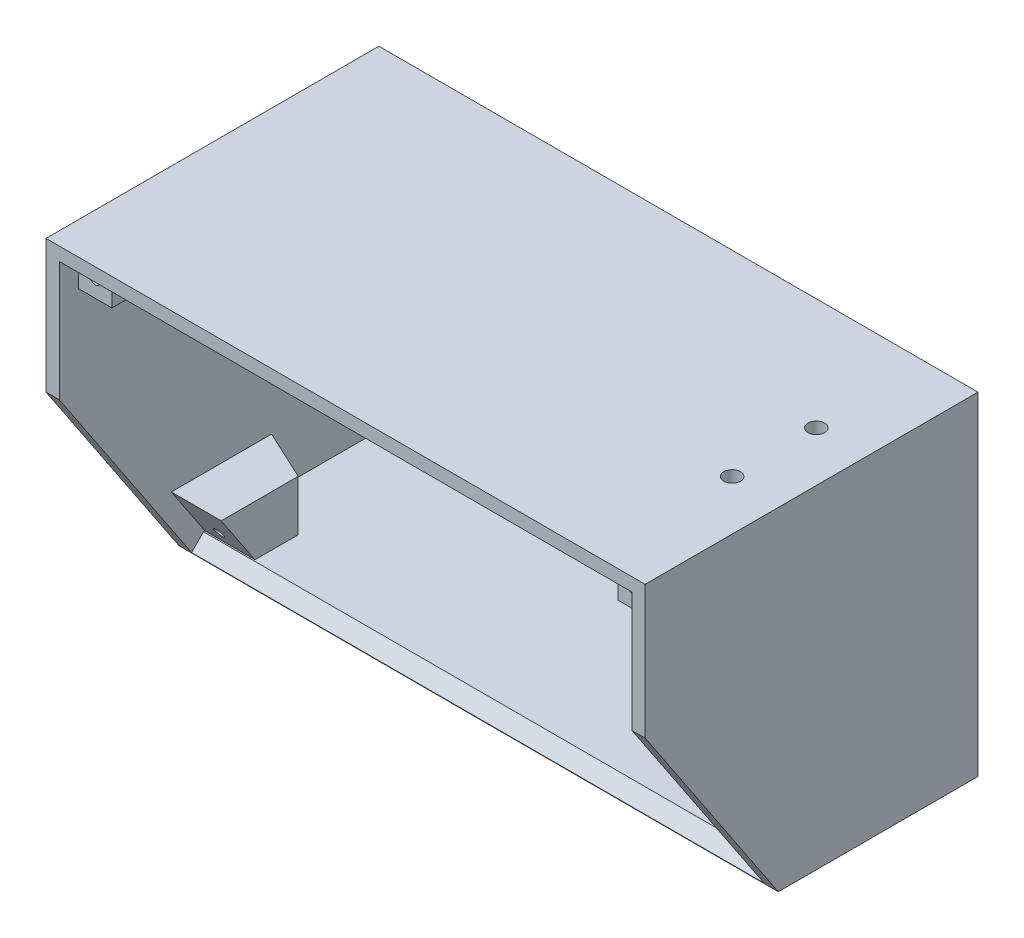
from build123d import *

# Parameters (mm, degrees)
ESBO_O1_W                = 180
ESBO_O1_H                = 100
ESBO_O1_W_2              = 172
ESBO_O1_H_2              = 92
RESSALTO_EXTRUS_O1_DEPTH = 100
ESBO_O2_W                = 180
ESBO_O2_H                = 100
RESSALTO_EXTRUS_O2_DEPTH = 4
RESSALTO_EXTRUS_O3_DEPTH = 43
CORTE_EXTRUS_O1_DEPTH    = 263
CHANFRO1_SIZE            = 6
CHANFRO1_SIZE2           = 4.326661531
ESBO_O5_W                = 10
ESBO_O5_H                = 20
RESSALTO_EXTRUS_O4_DEPTH = 10
ESBO_O6_R                = 1.5
CORTE_EXTRUS_O2_DEPTH    = 32
ESBO_O7_R                = 2.5
CORTE_EXTRUS_O3_DEPTH    = 32
CHANFRO3_SIZE            = 4.663076582
CHANFRO3_SIZE_2          = 10
CHANFRO4_SIZE            = 10
CHANFRO4_SIZE_2          = 4.663076582
RESSALTO_EXTRUS_O5_DEPTH = 15
RESSALTO_EXTRUS_O6_DEPTH = 15
CHANFRO5_SIZE2           = 15
CHANFRO5_SIZE            = 6.994614872
CHANFRO6_SIZE2           = 15
CHANFRO6_SIZE            = 6.994614872
ESBO_O10_R               = 1.5
CORTE_EXTRUS_O4_DEPTH    = 5
ESBO_O11_W               = 11
ESBO_O11_H               = 26
ESBO_O11_R               = 2
RESSALTO_EXTRUS_O7_DEPTH = 5


# Some blends are built 0.0001 mm under size
with BuildPart() as part:
    # Esboço1 → Ressalto-extrusão1 (new body)
    with BuildSketch(Plane.XY):
        with Locations((90, 50)):
            Rectangle(ESBO_O1_W, ESBO_O1_H)
        with Locations((90, 50)):
            Rectangle(ESBO_O1_W_2, ESBO_O1_H_2, mode=Mode.SUBTRACT)
    extrude(amount=RESSALTO_EXTRUS_O1_DEPTH)

    # Esboço2 → Ressalto-extrusão2 (add)
    with BuildSketch(Plane(origin=(0, 0, 0), x_dir=(-1, 0, 0), z_dir=(0, 0, -1))):
        with Locations((-90, 50)):
            Rectangle(ESBO_O2_W, ESBO_O2_H)
    extrude(amount=-RESSALTO_EXTRUS_O2_DEPTH)

    # Esboço3 → Ressalto-extrusão3 (add)
    with BuildSketch(Plane.XY.offset(4)):
        Polygon((30, 96), (30, 78), (57, 78), (57, 96), (61, 96), (61, 78), (88, 78), (88, 96), (92, 96), (92, 78), (119, 78), (119, 96), (123, 96), (123, 78), (150, 78), (150, 96), (154, 96), (154, 74), (26, 74), (26, 96), align=None)
    extrude(amount=RESSALTO_EXTRUS_O3_DEPTH)

    # Esboço4 → Corte-extrusão1 (cut)
    with BuildSketch(Plane.ZY):
        Polygon((60, 0), (100, 60), (100, 0), align=None)
    extrude(amount=-CORTE_EXTRUS_O1_DEPTH, mode=Mode.SUBTRACT)

    # Chanfro1
    chanfro1_edges = [part.edges().sort_by_distance(p)[0] for p in [
        (90, 4, 62.666666667),
    ]]
    chanfro1_side = [part.faces().sort_by_distance(p)[0] for p in [
        (90, 4, 33.333333333),
    ]]
    chamfer(chanfro1_edges, length=CHANFRO1_SIZE, length2=CHANFRO1_SIZE2, reference=chanfro1_side[0])

    # Esboço5 → Ressalto-extrusão4 (add)
    with BuildSketch(Plane.XZ.offset(-96)):
        with Locations((9, 84.2)):
            Rectangle(ESBO_O5_W, ESBO_O5_H)
        with Locations((171, 84.2)):
            Rectangle(ESBO_O5_W, ESBO_O5_H)
    extrude(amount=RESSALTO_EXTRUS_O4_DEPTH)

    # Esboço6 → Corte-extrusão2 (cut)
    with BuildSketch(Plane.XY.offset(94.2)):
        with Locations((171, 91)):
            Circle(ESBO_O6_R)
        with Locations((9, 91)):
            Circle(ESBO_O6_R)
    extrude(amount=-CORTE_EXTRUS_O2_DEPTH, mode=Mode.SUBTRACT)

    # Esboço7 → Corte-extrusão3 (cut)
    with BuildSketch(Plane.XZ.offset(-96)):
        with Locations(Location((165, 58.88, 0), (0, 0, 270))):
            Circle(ESBO_O7_R)
        with Locations(Location((165, 33.58, 0), (0, 0, 270))):
            Circle(ESBO_O7_R)
    extrude(amount=-CORTE_EXTRUS_O3_DEPTH, mode=Mode.SUBTRACT)

    # Chanfro3
    # the kernel refuses this chamfer: 10, 4.663076582 mm, written as the material it adds along each edge
    with BuildSketch(Plane(origin=(176, 96, 74.2), x_dir=(0.07481330637059742, 0, -0.9971975577536776), z_dir=(0, -1, 0))) as chanfro3_piece_1_section:
        Polygon((CHANFRO3_SIZE * 0.997197557657, -CHANFRO3_SIZE * 0.0748133063634), (-CHANFRO3_SIZE_2 * 0.0748133063706, -CHANFRO3_SIZE_2 * 0.997197557754), (0, 0), align=None)
    chanfro3_piece_1 = extrude(amount=10, mode=Mode.PRIVATE)
    chanfro3_piece_1 = split(chanfro3_piece_1, bisect_by=Plane(origin=(166, 91.000000816, 72.695597538), z_dir=(1, 0, 0)), keep=Keep.TOP, mode=Mode.PRIVATE)
    chanfro3_piece_1 = chanfro3_piece_1 - Plane(origin=(171, 91, 72.695597538), x_dir=(1, 0, 0), z_dir=(0, 0, 1)) * Cylinder(1.5, 60, mode=Mode.PRIVATE)
    add(chanfro3_piece_1)

    # Chanfro4
    # the kernel refuses this chamfer: 10, 4.663076582 mm, written as the material it adds along each edge
    with BuildSketch(Plane(origin=(4, 96, 74.2), x_dir=(0.9998669641130704, 0, 0.01631116413111014), z_dir=(0, -1, 0))) as chanfro4_piece_1_section:
        Polygon((CHANFRO4_SIZE * 0.999866964113, -CHANFRO4_SIZE * 0.0163111641311), (-CHANFRO4_SIZE_2 * 0.0163111641295, -CHANFRO4_SIZE_2 * 0.999866964017), (0, 0), align=None)
    chanfro4_piece_1 = extrude(amount=10, mode=Mode.PRIVATE)
    chanfro4_piece_1 = chanfro4_piece_1 - Plane(origin=(9, 91, 72.695597727), x_dir=(1, 0, 0), z_dir=(0, 0, 1)) * Cylinder(1.5, 60, mode=Mode.PRIVATE)
    chanfro4_piece_1 = split(chanfro4_piece_1, bisect_by=Plane(origin=(14, 91.000000829, 72.695597727), z_dir=(-1, 0, 0)), keep=Keep.TOP, mode=Mode.PRIVATE)
    add(chanfro4_piece_1)

    # Esboço8 → Ressalto-extrusão5 (add)
    with BuildSketch(Plane.ZY.offset(-176)):
        Polygon((56.224748388, 4), (66.358081721, 19.2), (43.224748388, 19.2), (43.224748388, 4), align=None)
    extrude(amount=RESSALTO_EXTRUS_O5_DEPTH)

    # Esboço9 → Ressalto-extrusão6 (add)
    with BuildSketch(Plane(origin=(4, 0, 0), x_dir=(0, 0, -1), z_dir=(1, 0, 0))):
        Polygon((-43.224748388, 19.2), (-66.358081721, 19.2), (-56.224748388, 4), (-43.224748388, 4), align=None)
    extrude(amount=RESSALTO_EXTRUS_O6_DEPTH)

    # Chanfro5
    chanfro5_edges = [part.edges().sort_by_distance(p)[0] for p in [
        (176, 11.6, 43.224748388),
    ]]
    chanfro5_side = [part.faces().sort_by_distance(p)[0] for p in [
        (176, 11.6, 43.08485609),
    ]]
    chamfer(chanfro5_edges, length=CHANFRO5_SIZE - 0.0001, length2=CHANFRO5_SIZE2 - 0.0001, reference=chanfro5_side[0])  # a hair under: the kernel refuses the full size

    # Chanfro6
    chanfro6_edges = [part.edges().sort_by_distance(p)[0] for p in [
        (4, 11.6, 43.224748388),
    ]]
    chanfro6_side = [part.faces().sort_by_distance(p)[0] for p in [
        (4, 11.6, 43.08485609),
    ]]
    chamfer(chanfro6_edges, length=CHANFRO6_SIZE - 0.0001, length2=CHANFRO6_SIZE2 - 0.0001, reference=chanfro6_side[0])  # a hair under: the kernel refuses the full size

    # Esboço10 → Corte-extrusão4 (cut)
    with BuildSketch(Plane(origin=(0, -24.719114641, 37.078671961), x_dir=(1, 0, 0), z_dir=(0, -0.5547001962252299, 0.8320502943378433))):
        with Locations(Location((11.5, 40.361212297, 0), (0, 0, 270))):
            Circle(ESBO_O10_R)
        with Locations(Location((168.5, 40.375568889, 0), (0, 0, 270))):
            Circle(ESBO_O10_R)
    extrude(amount=-CORTE_EXTRUS_O4_DEPTH, mode=Mode.SUBTRACT)

    # Esboço11 → Ressalto-extrusão7 (add)
    # profile 1 of 2: a face of its own
    with BuildSketch(Plane.XY.offset(4)):
        with Locations((122.5, 39)):
            Rectangle(ESBO_O11_W, ESBO_O11_H)
        with Locations((122.5, 45.5)):
            Circle(ESBO_O11_R, mode=Mode.SUBTRACT)
        with Locations((122.5, 32.5)):
            Circle(ESBO_O11_R, mode=Mode.SUBTRACT)
    # profile 2 of 2: a face of its own
    with BuildSketch(Plane.XY.offset(4)):
        with Locations((86.5, 39)):
            Rectangle(ESBO_O11_W, ESBO_O11_H)
        with Locations((86.5, 45.5)):
            Circle(ESBO_O11_R, mode=Mode.SUBTRACT)
        with Locations((86.5, 32.5)):
            Circle(ESBO_O11_R, mode=Mode.SUBTRACT)
    extrude(amount=RESSALTO_EXTRUS_O7_DEPTH)


solid = part.part
